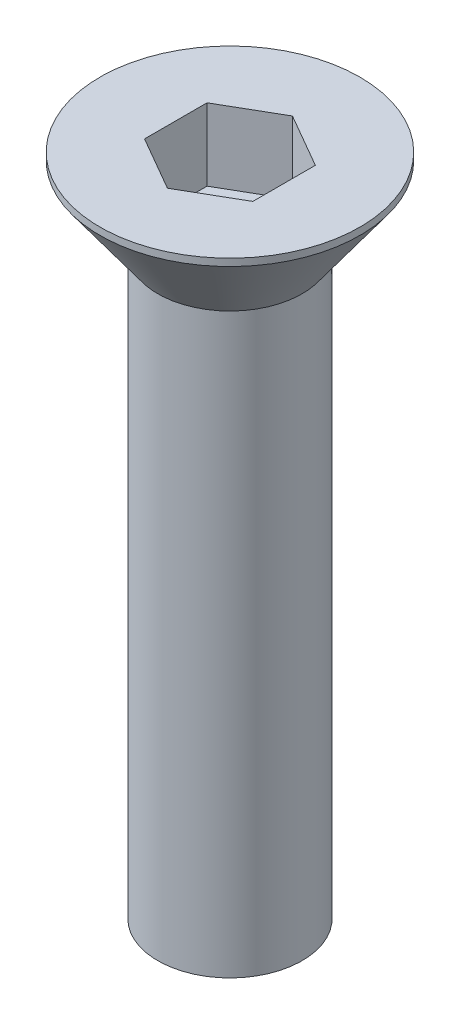
from build123d import *

# Parameters (mm, degrees)
CUT_EXTRUDE_1_DEPTH = 1
SKETCH_3_R          = 1
EXTRUDE_2_DEPTH     = 8


with BuildPart() as part:
    # 草图1 → 旋转1 (revolve)
    with BuildSketch(Plane.XY):
        Polygon((1.8, 0), (0, 0), (0, -1.2), (1, -1.2), (1.8, -0.1), align=None)
    revolve(axis=Axis((0, 0, 0), (0, 1, 0)))

    # 草图2 → 切除-拉伸1 (cut)
    with BuildSketch(Plane(origin=(0, 0, 0), x_dir=(1, 0, 0), z_dir=(0, 1, 0))):
        Polygon((0, -0.866025404), (0.75, -0.433012702), (0.75, 0.433012702), (0, 0.866025404), (-0.75, 0.433012702), (-0.75, -0.433012702), align=None)
    extrude(amount=-CUT_EXTRUDE_1_DEPTH, mode=Mode.SUBTRACT)

    # 草图3 → 凸台-拉伸2 (add)
    with BuildSketch(Plane.XZ.offset(1.2)):
        Circle(SKETCH_3_R)
    extrude(amount=EXTRUDE_2_DEPTH)


solid = part.part
